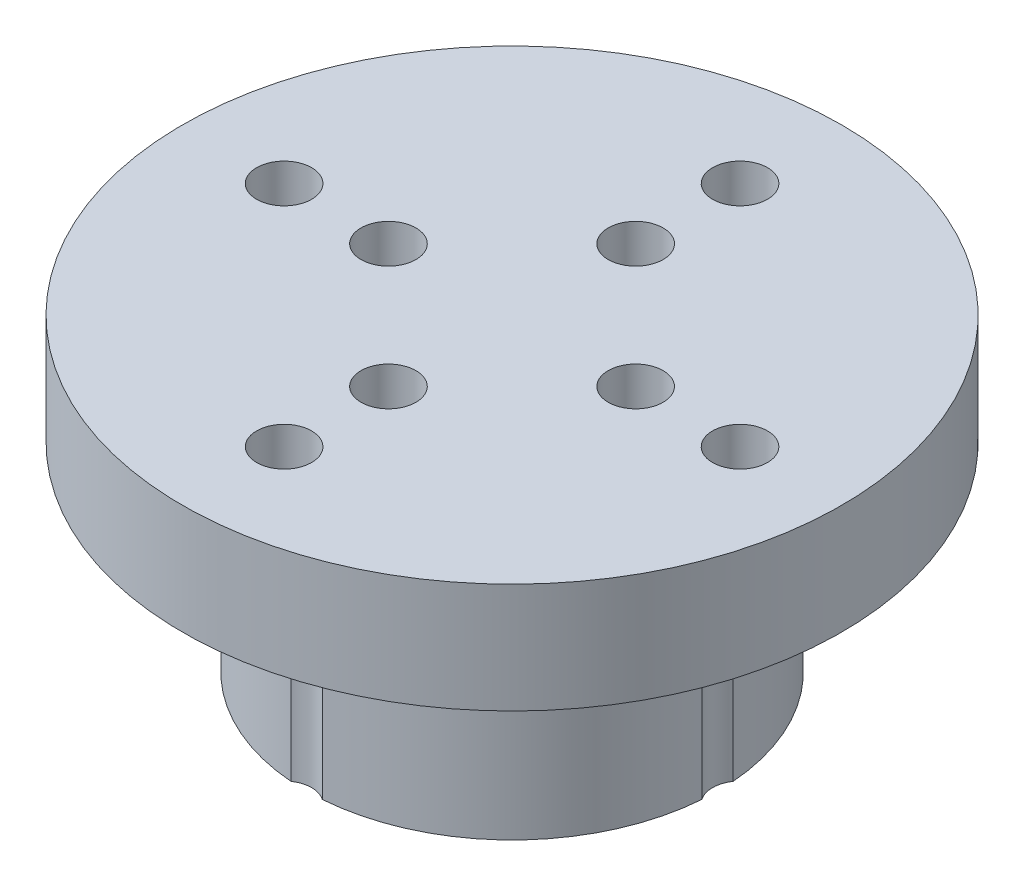
from build123d import *

# Parameters (mm, degrees)
SKETCH2_R          = 1
CUT_EXTRUDE1_DEPTH = 21.360807941
CIRPATTERN1_COUNT  = 4


with BuildPart() as part:
    # Sketch1 → Revolve1 (revolve)
    with BuildSketch(Plane.XY):
        Polygon((0, 11.25), (0, 0), (7.5, 0), (7.5, 5.25), (8.5, 5.25), (8.5, 7.25), (12, 7.25), (12, 11.25), align=None)
    revolve(axis=Axis((0, 0, 0), (0, 1, 0)))

    # Sketch2 → Cut-Extrude1 (cut, through all)
    with BuildSketch(Plane(origin=(0, 11.25, 0), x_dir=(1, 0, 0), z_dir=(0, 1, 0))):
        with Locations((8.3, 0)):
            Circle(SKETCH2_R)
        with Locations((4.5, 0)):
            Circle(SKETCH2_R)
    cut_extrude1 = extrude(amount=-CUT_EXTRUDE1_DEPTH, mode=Mode.SUBTRACT)

    # CirPattern1: Cut-Extrude1 ×4 about axis
    cirpattern1_axis = Axis((0, 11.25, 0), (0, -1, 0))
    for i in range(1, CIRPATTERN1_COUNT):
        add(cut_extrude1.rotate(cirpattern1_axis, i * 360 / CIRPATTERN1_COUNT), mode=Mode.SUBTRACT)


solid = part.part
